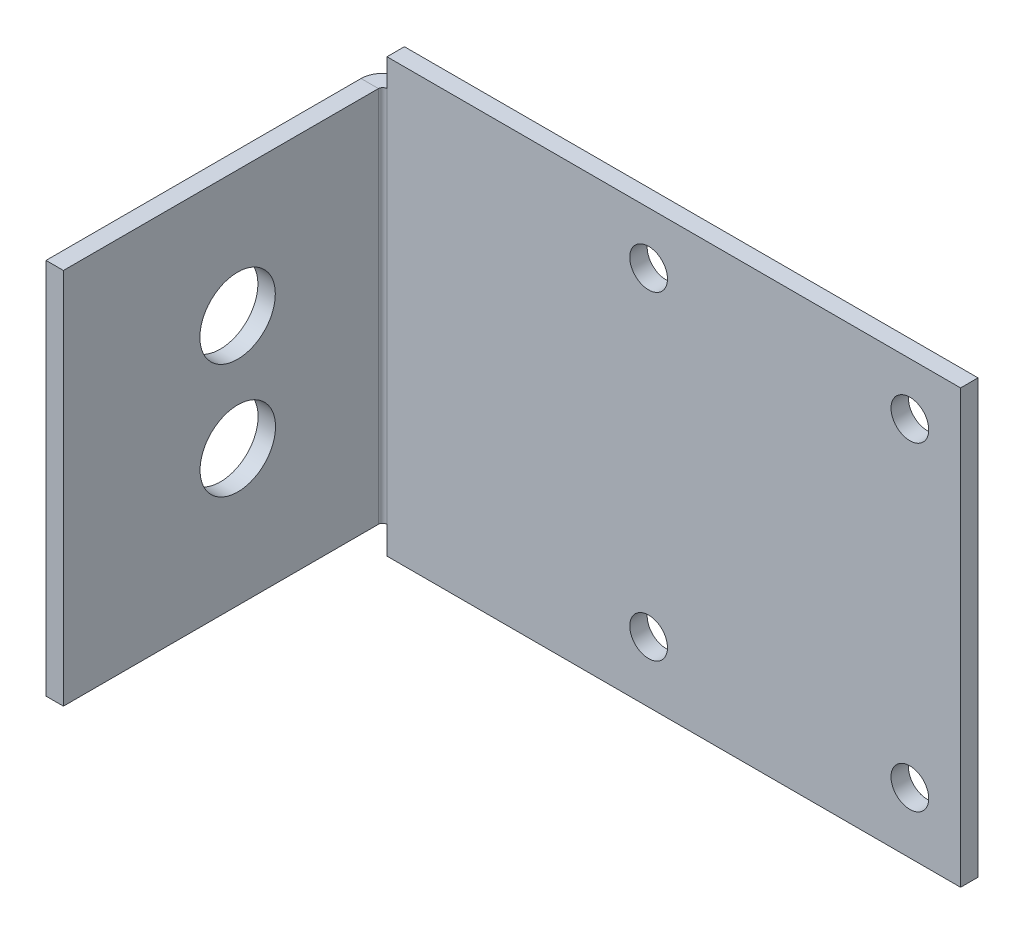
from build123d import *

# Parameters (mm, degrees)
SKETCH2_W               = 98.8
SKETCH2_H               = 74.5
BASE_FLANGE1_DEPTH      = 3
KENAR_FLAN_1_DEPTH      = 65
KENAR_FLAN_1_START      = 3
KENAR_FLAN_1_PROFILE_W  = 65
KENAR_FLAN_1_PROFILE_H  = 54.2634
KENAR_FLAN_1_PROFILE_R  = 6.5
KENAR_FLAN_1_FLAT_DEPTH = 3
SKETCH10_R              = 3.25
CUT_EXTRUDE2_DEPTH      = 10


# Sheet-metal steps are written as plain solids
with BuildPart() as part:
    # Sketch2 → Base-Flange1 (new body)
    with BuildSketch(Plane.XY):
        Rectangle(SKETCH2_W, SKETCH2_H)
    extrude(amount=-BASE_FLANGE1_DEPTH)

    # Kenar-Flanş1 bend section (across the edge) → Kenar-Flanş1 (add)
    with BuildSketch(Plane(origin=(-50.1366, 32.5, 0), x_dir=(1, 0, 0), z_dir=(0, -1, 0))):
        with BuildLine():
            Line((-3, 0.7366), (0, 0.7366))
            ThreePointArc((0, 0.7366), (0.215745145, 0.215745145), (0.7366, 0))
            Line((0.7366, 0), (0.7366, -3))
            ThreePointArc((0.7366, -3), (-1.905575199, -1.905575199), (-3, 0.7366))
        make_face()
    extrude(amount=KENAR_FLAN_1_DEPTH)

    # Kenar-Flanş1 profile (on flange) → Kenar-Flanş1 flat (add)
    with BuildSketch(Plane(origin=(-50.1366, 0, 0), x_dir=(0, -1, 0), z_dir=(-1, 0, 0)).offset(KENAR_FLAN_1_START)):
        with Locations((0, 27.8683)):
            Rectangle(KENAR_FLAN_1_PROFILE_W, KENAR_FLAN_1_PROFILE_H)
        with Locations((9.057623393, 24.966787755)):
            Circle(KENAR_FLAN_1_PROFILE_R, mode=Mode.SUBTRACT)
        with Locations((-10.75, 25)):
            Circle(KENAR_FLAN_1_PROFILE_R, mode=Mode.SUBTRACT)
    extrude(amount=-KENAR_FLAN_1_FLAT_DEPTH)

    # Sketch10 → Cut-Extrude2 (cut)
    with BuildSketch(Plane.XY):
        with Locations((40.6634, -26.75)):
            Circle(SKETCH10_R)
        with Locations((-4.3366, -26.75)):
            Circle(SKETCH10_R)
        with Locations((-4.3366, 28.25)):
            Circle(SKETCH10_R)
        with Locations((40.6634, 28.25)):
            Circle(SKETCH10_R)
    extrude(amount=-CUT_EXTRUDE2_DEPTH, mode=Mode.SUBTRACT)


solid = part.part
